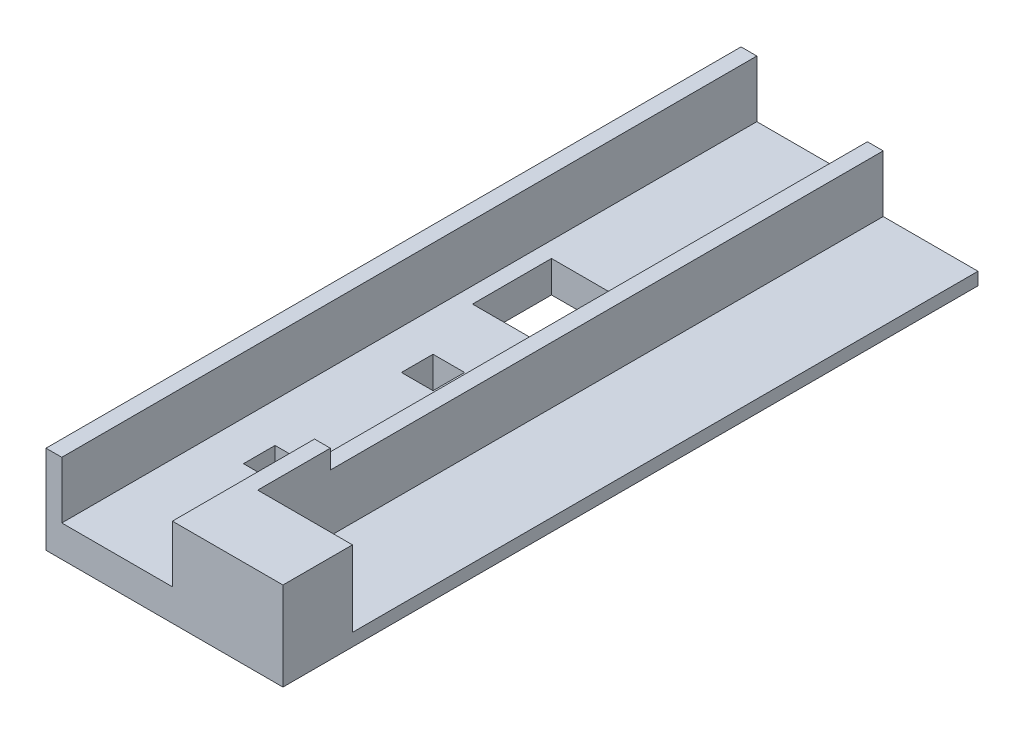
from build123d import *

# Parameters (mm, degrees)
DODANIE_WYCI_GNI_CIE1_DEPTH = 220
SZKIC4_W                    = 30
SZKIC4_H                    = 24
DODANIE_WYCI_GNI_CIE3_DEPTH = 5
SZKIC5_W                    = 10
SZKIC5_H                    = 10
SZKIC5_W_2                  = 25
SZKIC5_H_2                  = 25
WYTNIJ_WYCI_GNI_CIE1_DEPTH  = 25
SZKIC6_W                    = 5
SZKIC6_H                    = 175
WYTNIJ_WYCI_GNI_CIE2_DEPTH  = 6
SZKIC7_W                    = 30
SZKIC7_H                    = 24
DODANIE_WYCI_GNI_CIE4_DEPTH = 10
SZKIC9_W                    = 30
SZKIC9_H                    = 24
SZKIC9_R                    = 11.25
DODANIE_WYCI_GNI_CIE5_DEPTH = 7


with BuildPart() as part:
    # Szkic1 → Dodanie-wyciągnięcie1 (new body)
    with BuildSketch(Plane.XY):
        Polygon((22.5, 18), (17.5, 18), (17.5, 0), (-17.5, 0), (-17.5, 18), (-22.5, 18), (-22.5, -10), (52.5, -10), (52.5, -6), (22.5, -6), align=None)
    extrude(amount=-DODANIE_WYCI_GNI_CIE1_DEPTH)

    # Szkic4 → Dodanie-wyciągnięcie3 (add)
    with BuildSketch(Plane.XY):
        with Locations((37.5, 6)):
            Rectangle(SZKIC4_W, SZKIC4_H)
    extrude(amount=-DODANIE_WYCI_GNI_CIE3_DEPTH)

    # Szkic5 → Wytnij-wyciągnięcie1 (cut)
    with BuildSketch(Plane(origin=(0, 0, 0), x_dir=(1, 0, 0), z_dir=(0, 1, 0))):
        with Locations((0, 50)):
            Rectangle(SZKIC5_W, SZKIC5_H)
        with Locations((0, 100)):
            Rectangle(SZKIC5_W, SZKIC5_H)
        with Locations((0, 137.5)):
            Rectangle(SZKIC5_W_2, SZKIC5_H_2)
    extrude(amount=-WYTNIJ_WYCI_GNI_CIE1_DEPTH, mode=Mode.SUBTRACT)

    # Szkic6 → Wytnij-wyciągnięcie2 (cut)
    with BuildSketch(Plane(origin=(0, 18, 0), x_dir=(1, 0, 0), z_dir=(0, 1, 0))):
        with Locations((20, 132.5)):
            Rectangle(SZKIC6_W, SZKIC6_H)
    extrude(amount=-WYTNIJ_WYCI_GNI_CIE2_DEPTH, mode=Mode.SUBTRACT)

    # Szkic7 → Dodanie-wyciągnięcie4 (add)
    with BuildSketch(Plane(origin=(0, 0, -5), x_dir=(-1, 0, 0), z_dir=(0, 0, -1))):
        with Locations((-37.5, 6)):
            Rectangle(SZKIC7_W, SZKIC7_H)
        with BuildLine():
            Line((-39.596551211, 15.5), (-35.403448789, 15.5))
            Line((-35.403448789, 15.5), (-31.701724394, 11.798275606))
            ThreePointArc((-31.701724394, 11.798275606), (-37.5, -2.2), (-43.298275606, 11.798275606))
            Line((-43.298275606, 11.798275606), (-39.596551211, 15.5))
        make_face(mode=Mode.SUBTRACT)
    extrude(amount=DODANIE_WYCI_GNI_CIE4_DEPTH)

    # Szkic9 → Dodanie-wyciągnięcie5 (add)
    with BuildSketch(Plane(origin=(0, 0, -15), x_dir=(-1, 0, 0), z_dir=(0, 0, -1))):
        with Locations((-37.5, 6)):
            Rectangle(SZKIC9_W, SZKIC9_H)
        with Locations((-37.5, 6)):
            Circle(SZKIC9_R, mode=Mode.SUBTRACT)
    extrude(amount=DODANIE_WYCI_GNI_CIE5_DEPTH)


solid = part.part
